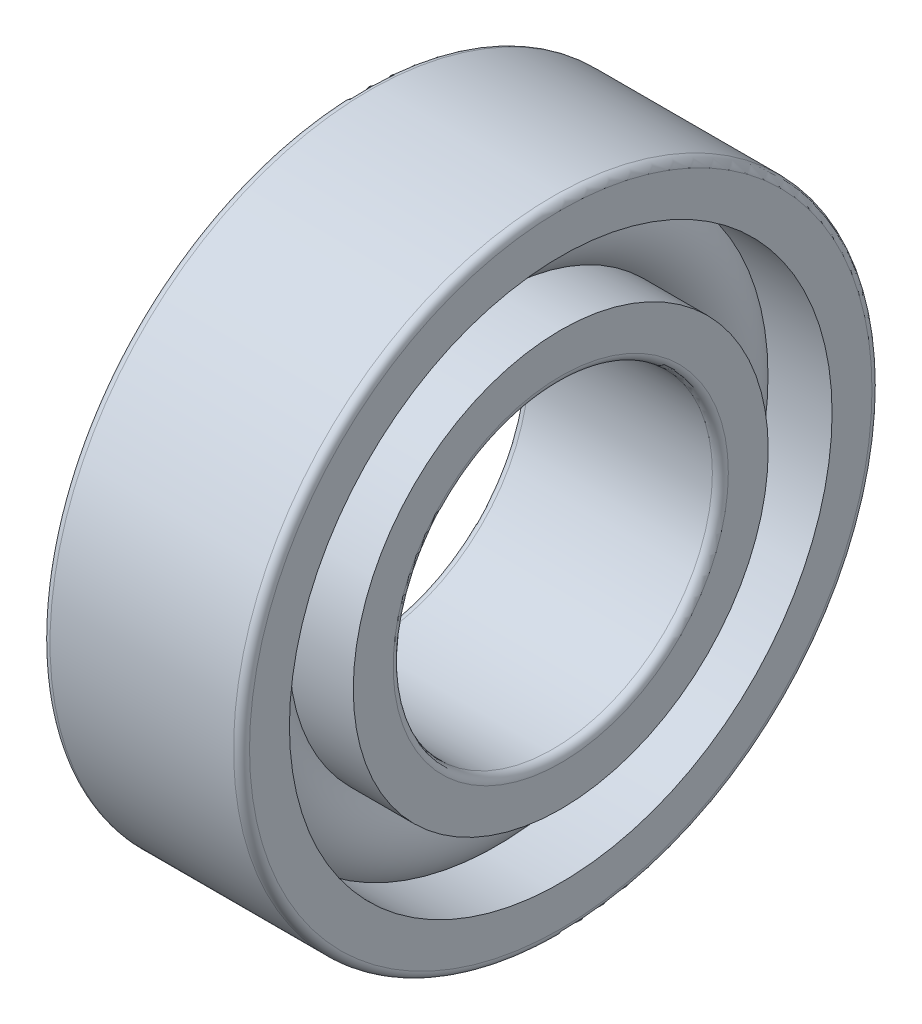
from build123d import *

# Parameters (mm, degrees)
CAGSPISKE_W     = 0.24
CAGSPISKE_H     = 0.4
CAGESPINE_ANGLE = 0.001
BALSIMSKE_R     = 1.2


with BuildPart() as part:
    # CagSpiSke → CageSpine (revolve)
    with BuildSketch(Plane.XY):
        with Locations((0, 6)):
            Rectangle(CAGSPISKE_W, CAGSPISKE_H)
    revolve(axis=Axis((-20.6375, 0, 0), (-1, 0, 0)), revolution_arc=CAGESPINE_ANGLE)

    # BalSimSke → BallsSimplified (revolve)
    with BuildSketch(Plane.XY):
        with Locations((0, 6)):
            Circle(BALSIMSKE_R)
    revolve(axis=Axis((-10, 0, 0), (1, 0, 0)))

    # InnRacSke → InnerRace (revolve)
    with BuildSketch(Plane.XY):
        with BuildLine():
            Line((-0.860595724, 5.2), (-2.5, 5.2))
            Line((-2.5, 5.2), (-2.5, 4.2))
            ThreePointArc((-2.5, 4.2), (-2.441421356, 4.058578644), (-2.3, 4))
            Line((-2.3, 4), (2.3, 4))
            ThreePointArc((2.3, 4), (2.441421356, 4.058578644), (2.5, 4.2))
            Line((2.5, 4.2), (2.5, 5.2))
            Line((2.5, 5.2), (0.860595724, 5.2))
            ThreePointArc((0.860595724, 5.2), (0, 4.825), (-0.860595724, 5.2))
        make_face()
    revolve(axis=Axis((-20.6375, 0, 0), (1, 0, 0)))

    # OutRacSke → OuterRace (revolve)
    with BuildSketch(Plane.XY):
        with BuildLine():
            Line((-0.860595724, 6.8), (-2.5, 6.8))
            Line((-2.5, 6.8), (-2.5, 7.8))
            ThreePointArc((-2.5, 7.8), (-2.441421356, 7.941421356), (-2.3, 8))
            Line((-2.3, 8), (2.3, 8))
            ThreePointArc((2.3, 8), (2.441421356, 7.941421356), (2.5, 7.8))
            Line((2.5, 7.8), (2.5, 6.8))
            Line((2.5, 6.8), (0.860595724, 6.8))
            ThreePointArc((0.860595724, 6.8), (0, 7.175), (-0.860595724, 6.8))
        make_face()
    revolve(axis=Axis((-20.6375, 0, 0), (1, 0, 0)))


solid = part.part
